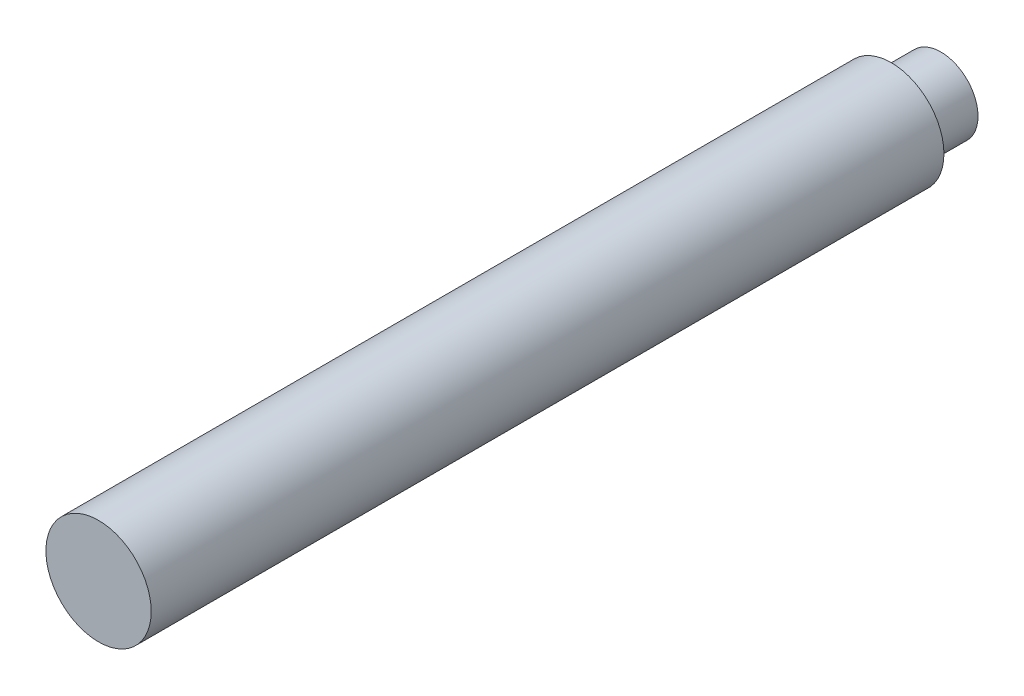
from build123d import *

# Parameters (mm, degrees)
EXTRUDE_1_DEPTH      = 4
EXTRUDE_START        = -4
SKETCH_1_3_R         = 3
EXTRUDE_2_DEPTH      = 4
EXTRUDE_5_DEPTH      = 60
EXTRUDE_5_DEPTH_BACK = 4
SKETCH_2_R           = 4.25
OTHER_2_DEPTH        = 4.05
OTHER_2_2_DEPTH      = 0.05


# Read off the part's stored shape, not the designer's step: 压凹2
with BuildPart() as part:
    # 草图1 → 凸台-拉伸1 (new body)
    with BuildSketch(Plane.XY):
        with BuildLine():
            Line((2.598076211, 1.5), (-2.598076211, 1.5))
            ThreePointArc((-2.598076211, 1.5), (-0.776457135, -2.897777479), (3, 0))
            ThreePointArc((3, 0), (2.897777479, 0.776457135), (2.598076211, 1.5))
        make_face()
    extrude(amount=EXTRUDE_1_DEPTH)

    # 草图1<3> → 凸台-拉伸2 (add)
    with BuildSketch(Plane.XY.offset(EXTRUDE_START)):
        with Locations(Location((0, 0, 0), (0, 0, 150))):
            Circle(SKETCH_1_3_R)
    extrude(amount=EXTRUDE_2_DEPTH)


with BuildPart() as body_2:
    # 草图2 → 凸台-拉伸5 (new, two sides: drawn at the far end of the back side and taken through both)
    with BuildSketch(Plane.XY.offset(4).offset(-EXTRUDE_5_DEPTH_BACK)):
        Circle(SKETCH_2_R)
    extrude(amount=EXTRUDE_5_DEPTH + EXTRUDE_5_DEPTH_BACK)

    # 压凹2 outline → 压凹2 (cut)
    with BuildSketch(Plane.XY):
        with BuildLine():
            ThreePointArc((-2.626785107, 1.55), (0, -3.05), (2.626785107, 1.55))
            Line((2.626785107, 1.55), (-2.626785107, 1.55))
        make_face()
    extrude(amount=OTHER_2_DEPTH, mode=Mode.SUBTRACT)

    # Other 2 2 outline → Other 2 2 (cut)
    with BuildSketch(Plane.XY):
        with BuildLine():
            Line((-2.626785107, 1.55), (2.626785107, 1.55))
            ThreePointArc((2.626785107, 1.55), (0, 3.05), (-2.626785107, 1.55))
        make_face()
    extrude(amount=OTHER_2_2_DEPTH, mode=Mode.SUBTRACT)


solid = Compound([part.part, body_2.part])
